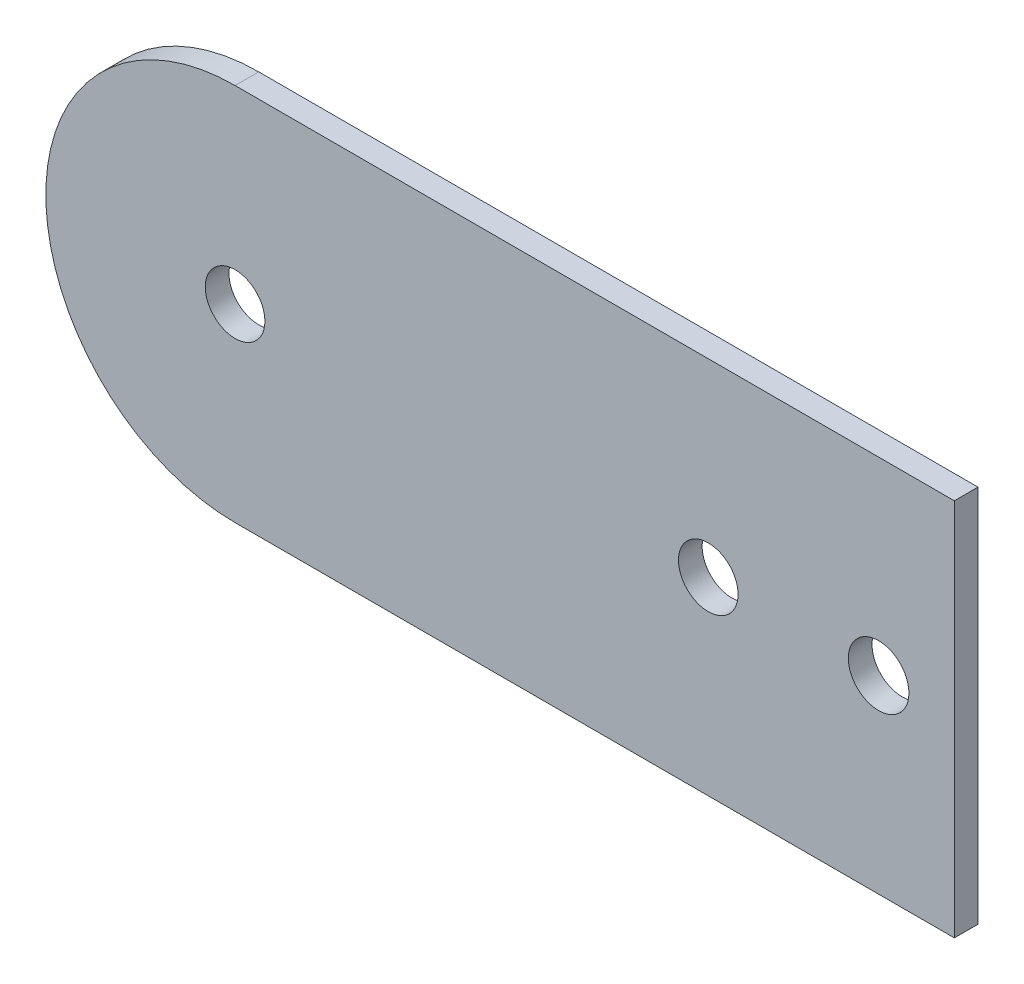
from build123d import *

# Parameters (mm, degrees)
SKETCH1_R           = 2
SKETCH1_R_2         = 2.032
BOSS_EXTRUDE1_DEPTH = 1.5875


with BuildPart() as part:
    # Sketch1 → Boss-Extrude1 (new body)
    with BuildSketch(Plane.XY):
        with BuildLine():
            Line((0, -12.7), (48.26, -12.7))
            Line((48.26, -12.7), (48.26, 12.7))
            Line((48.26, 12.7), (0, 12.7))
            ThreePointArc((0, 12.7), (-12.7, 0), (0, -12.7))
        make_face()
        Circle(SKETCH1_R, mode=Mode.SUBTRACT)
        with Locations((31.75, 0)):
            Circle(SKETCH1_R, mode=Mode.SUBTRACT)
        with Locations((43.18, 0)):
            Circle(SKETCH1_R_2, mode=Mode.SUBTRACT)
    extrude(amount=BOSS_EXTRUDE1_DEPTH)


solid = part.part
